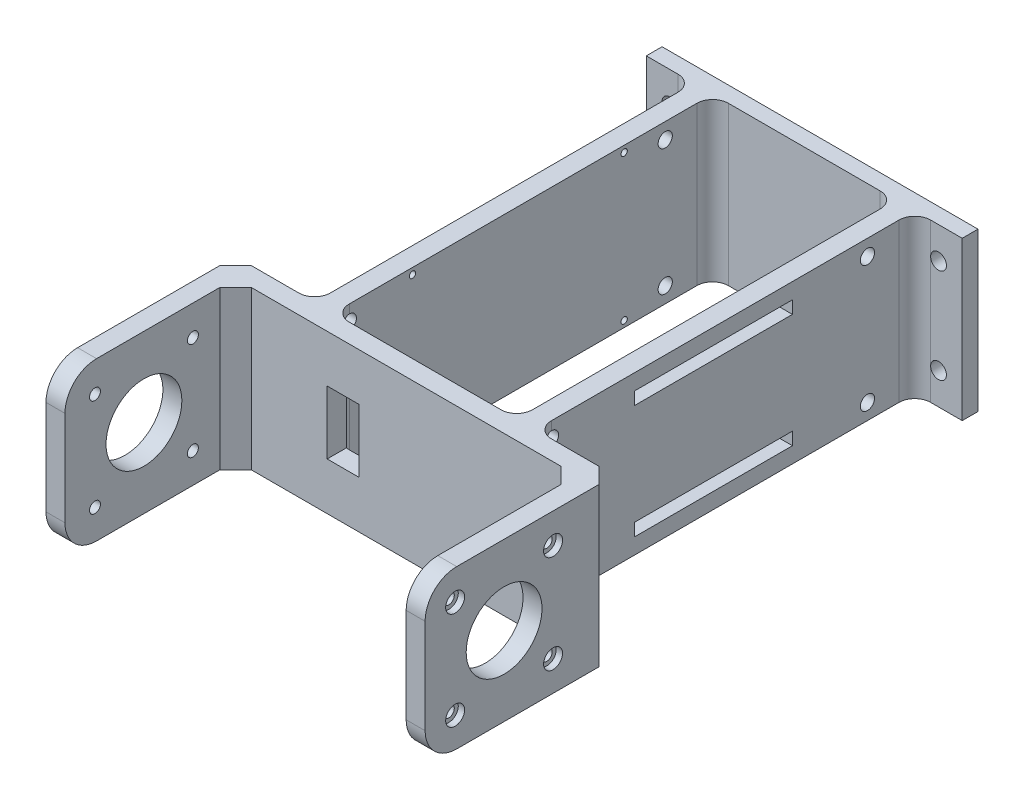
from build123d import *

# Parameters (mm, degrees)
SKETCH1_W           = 120
SKETCH1_H           = 65
SKETCH1_W_2         = 108
SKETCH1_H_2         = 54
BOSS_EXTRUDE1_DEPTH = 50
SKETCH4_R           = 12
CUT_EXTRUDE1_DEPTH  = 156
SKETCH7_R           = 1.735318072
CUT_EXTRUDE2_DEPTH  = 156
SKETCH9_R           = 3
CUT_EXTRUDE3_DEPTH  = 2
CUT_EXTRUDE4_START  = -2
SKETCH10_R          = 3
CUT_EXTRUDE4_DEPTH  = 2
SKETCH11_W          = 6
SKETCH11_H          = 50
BOSS_EXTRUDE2_DEPTH = 120
SKETCH13_W          = 120
SKETCH13_H          = 5
CUT_EXTRUDE5_DEPTH  = 120
FILLET1_R           = 10
SKETCH14_W          = 100
SKETCH14_H          = 50
BOSS_EXTRUDE3_DEPTH = 5
SKETCH15_R          = 2.5
CUT_EXTRUDE6_DEPTH  = 18
SKETCH16_W          = 50
SKETCH16_H          = 4
CUT_EXTRUDE7_DEPTH  = 18
SKETCH17_R          = 1
CUT_EXTRUDE8_DEPTH  = 18
SKETCH18_W          = 10
SKETCH18_H          = 20
CUT_EXTRUDE9_DEPTH  = 18
SKETCH22_R          = 2.25
CUT_EXTRUDE13_DEPTH = 75
CHAMFER1_SIZE       = 5
CHAMFER2_SIZE       = 5
FILLET2_R           = 5


with BuildPart() as part:
    # Sketch1 → Boss-Extrude1 (new body)
    with BuildSketch(Plane(origin=(0, 0, 0), x_dir=(1, 0, 0), z_dir=(0, 1, 0))):
        with Locations((0, 2.5)):
            Rectangle(SKETCH1_W, SKETCH1_H)
        with Locations((0, 2)):
            Rectangle(SKETCH1_W_2, SKETCH1_H_2, mode=Mode.SUBTRACT)
    extrude(amount=BOSS_EXTRUDE1_DEPTH)

    # Sketch4 → Cut-Extrude1 (cut)
    with BuildSketch(Plane.ZY.offset(60)):
        with Locations((0, 25)):
            Circle(SKETCH4_R)
    extrude(amount=-CUT_EXTRUDE1_DEPTH, mode=Mode.SUBTRACT)

    # Sketch7 → Cut-Extrude2 (cut)
    with BuildSketch(Plane.ZY.offset(60)):
        with Locations((-15.5, 9.5)):
            Circle(SKETCH7_R)
        with Locations((-15.5, 40.5)):
            Circle(SKETCH7_R)
        with Locations((15.5, 9.5)):
            Circle(SKETCH7_R)
        with Locations((15.5, 40.5)):
            Circle(SKETCH7_R)
    extrude(amount=-CUT_EXTRUDE2_DEPTH, mode=Mode.SUBTRACT)

    # Sketch9 → Cut-Extrude3 (cut)
    with BuildSketch(Plane(origin=(60, 0, 0), x_dir=(0, 0, -1), z_dir=(1, 0, 0))):
        with Locations((15.5, 40.5)):
            Circle(SKETCH9_R)
        with Locations((15.5, 9.5)):
            Circle(SKETCH9_R)
        with Locations((-15.5, 9.5)):
            Circle(SKETCH9_R)
        with Locations((-15.5, 40.5)):
            Circle(SKETCH9_R)
    extrude(amount=-CUT_EXTRUDE3_DEPTH, mode=Mode.SUBTRACT)

    # Sketch10 → Cut-Extrude4 (cut)
    with BuildSketch(Plane.ZY.offset(60).offset(CUT_EXTRUDE4_START)):
        with Locations(Location((-15.5, 9.5, 0), (0, 0, 180))):
            Circle(SKETCH10_R)
        with Locations(Location((-15.5, 40.5, 0), (0, 0, 180))):
            Circle(SKETCH10_R)
        with Locations(Location((15.5, 40.5, 0), (0, 0, 180))):
            Circle(SKETCH10_R)
        with Locations(Location((15.5, 9.5, 0), (0, 0, 180))):
            Circle(SKETCH10_R)
    extrude(amount=CUT_EXTRUDE4_DEPTH, mode=Mode.SUBTRACT)

    # Sketch11 → Boss-Extrude2 (add)
    with BuildSketch(Plane(origin=(0, 0, -35), x_dir=(-1, 0, 0), z_dir=(0, 0, -1))):
        with Locations((-32, 25)):
            Rectangle(SKETCH11_W, SKETCH11_H)
        with Locations((32, 25)):
            Rectangle(SKETCH11_W, SKETCH11_H)
    extrude(amount=BOSS_EXTRUDE2_DEPTH)

    # Sketch13 → Cut-Extrude5 (cut)
    with BuildSketch(Plane(origin=(0, 50, 0), x_dir=(1, 0, 0), z_dir=(0, 1, 0))):
        with Locations((0, -27.5)):
            Rectangle(SKETCH13_W, SKETCH13_H)
    extrude(amount=-CUT_EXTRUDE5_DEPTH, mode=Mode.SUBTRACT)

    # Fillet1
    fillet1_edges = [part.edges().sort_by_distance(p)[0] for p in [
        (57, 0, 25),
        (-57, 0, 25),
        (57, 50, 25),
        (-57, 50, 25),
    ]]
    fillet(fillet1_edges, radius=FILLET1_R)

    # Sketch14 → Boss-Extrude3 (add)
    with BuildSketch(Plane(origin=(0, 0, -155), x_dir=(-1, 0, 0), z_dir=(0, 0, -1))):
        with Locations((0, 25)):
            Rectangle(SKETCH14_W, SKETCH14_H)
    extrude(amount=BOSS_EXTRUDE3_DEPTH)

    # Sketch15 → Cut-Extrude6 (cut)
    with BuildSketch(Plane(origin=(0, 0, -160), x_dir=(-1, 0, 0), z_dir=(0, 0, -1))):
        with Locations((-42.5, 10)):
            Circle(SKETCH15_R)
        with Locations((42.5, 10)):
            Circle(SKETCH15_R)
        with Locations((42.5, 40)):
            Circle(SKETCH15_R)
        with Locations((-42.5, 40)):
            Circle(SKETCH15_R)
    extrude(amount=-CUT_EXTRUDE6_DEPTH, mode=Mode.SUBTRACT)

    # Sketch16 → Cut-Extrude7 (cut)
    with BuildSketch(Plane(origin=(35, 0, 0), x_dir=(0, 0, -1), z_dir=(1, 0, 0))):
        with Locations((91.261804775, 43)):
            Rectangle(SKETCH16_W, SKETCH16_H)
        with Locations((91.261804775, 7)):
            Rectangle(SKETCH16_W, SKETCH16_H)
    extrude(amount=-CUT_EXTRUDE7_DEPTH, mode=Mode.SUBTRACT)

    # Sketch17 → Cut-Extrude8 (cut)
    with BuildSketch(Plane.ZY.offset(35)):
        with Locations(Location((-127, 2, 0), (0, 0, 270))):
            Circle(SKETCH17_R)
        with Locations(Location((-127, 48, 0), (0, 0, 270))):
            Circle(SKETCH17_R)
        with Locations(Location((-60, 2, 0), (0, 0, 270))):
            Circle(SKETCH17_R)
        with Locations(Location((-60, 48, 0), (0, 0, 270))):
            Circle(SKETCH17_R)
    extrude(amount=-CUT_EXTRUDE8_DEPTH, mode=Mode.SUBTRACT)

    # Sketch18 → Cut-Extrude9 (cut)
    with BuildSketch(Plane(origin=(0, 0, -35), x_dir=(-1, 0, 0), z_dir=(0, 0, -1))):
        with Locations((20, 25)):
            Rectangle(SKETCH18_W, SKETCH18_H)
    extrude(amount=-CUT_EXTRUDE9_DEPTH, mode=Mode.SUBTRACT)

    # Sketch22 → Cut-Extrude13 (cut)
    with BuildSketch(Plane.ZY.offset(35)):
        with Locations(Location((-140, 5, 0), (0, 0, 270))):
            Circle(SKETCH22_R)
        with Locations(Location((-140, 45, 0), (0, 0, 270))):
            Circle(SKETCH22_R)
        with Locations(Location((-40, 5, 0), (0, 0, 270))):
            Circle(SKETCH22_R)
        with Locations(Location((-40, 45, 0), (0, 0, 270))):
            Circle(SKETCH22_R)
    extrude(amount=-CUT_EXTRUDE13_DEPTH, mode=Mode.SUBTRACT)

    # Chamfer1
    chamfer1_edges = [part.edges().sort_by_distance(p)[0] for p in [
        (-60, 25, -35),
        (60, 25, -35),
    ]]
    chamfer(chamfer1_edges, length=CHAMFER1_SIZE)

    # Chamfer2
    chamfer2_edges = [part.edges().sort_by_distance(p)[0] for p in [
        (-54, 25, -29),
        (54, 25, -29),
    ]]
    chamfer(chamfer2_edges, length=CHAMFER2_SIZE)

    # Fillet2
    # the kernel refuses this fillet: 5 mm, written as the material it adds along each edge
    with BuildSketch(Plane(origin=(-29, 50, -155), x_dir=(1, 0, 0), z_dir=(0, -1, 0)), Plane(origin=(29, 0, -155), x_dir=(-1, 0, 0), z_dir=(0, 1, 0))) as fillet2_piece_1:
        with BuildLine():
            CenterArc((FILLET2_R, FILLET2_R), FILLET2_R, 180, 90)
            Line((0, FILLET2_R), (0, 0))
            Line((0, 0), (FILLET2_R, 0))
        make_face()
    extrude(amount=50)
    with BuildSketch(Plane(origin=(35, 50, -35), x_dir=(1, 0, 0), z_dir=(0, -1, 0))) as fillet2_piece_2_section:
        with BuildLine():
            CenterArc((FILLET2_R, -FILLET2_R), FILLET2_R, 90, 90)
            Line((0, -FILLET2_R), (0, 0))
            Line((0, 0), (FILLET2_R, 0))
        make_face()
    fillet2_piece_2 = extrude(amount=50, mode=Mode.PRIVATE)
    fillet2_piece_2 = fillet2_piece_2 - Plane(origin=(36.144503009, 45, -40), x_dir=(0, -1, 0), z_dir=(-1, 0, 0)) * Cylinder(2.25, 121, mode=Mode.PRIVATE)
    fillet2_piece_2 = fillet2_piece_2 - Plane(origin=(36.144503009, 5, -40), x_dir=(0, -1, 0), z_dir=(-1, 0, 0)) * Cylinder(2.25, 121, mode=Mode.PRIVATE)
    add(fillet2_piece_2)
    with BuildSketch(Plane(origin=(-29, 50, -35), x_dir=(0, 0, -1), z_dir=(0, -1, 0))) as fillet2_piece_3_section:
        with BuildLine():
            CenterArc((FILLET2_R, FILLET2_R), FILLET2_R, 180, 90)
            Line((0, FILLET2_R), (0, 0))
            Line((0, 0), (FILLET2_R, 0))
        make_face()
    fillet2_piece_3 = extrude(amount=50, mode=Mode.PRIVATE)
    fillet2_piece_3 = fillet2_piece_3 - Plane(origin=(-27.918643219, 45, -40), x_dir=(0, -1, 0), z_dir=(-1, 0, 0)) * Cylinder(2.25, 121, mode=Mode.PRIVATE)
    fillet2_piece_3 = split(fillet2_piece_3, bisect_by=Plane(origin=(-27.918643219, 35, -36.105806531), z_dir=(0, 1, 0)), keep=Keep.TOP, mode=Mode.PRIVATE)
    fillet2_piece_3 = split(fillet2_piece_3, bisect_by=Plane(origin=(-25, 42.450189762, -36.105806531), z_dir=(-1, 0, 0)), keep=Keep.TOP, mode=Mode.PRIVATE)
    add(fillet2_piece_3)
    with BuildSketch(Plane(origin=(-29, 50, -35), x_dir=(0, 0, -1), z_dir=(0, -1, 0))) as fillet2_piece_4_section:
        with BuildLine():
            CenterArc((FILLET2_R, FILLET2_R), FILLET2_R, 180, 90)
            Line((0, FILLET2_R), (0, 0))
            Line((0, 0), (FILLET2_R, 0))
        make_face()
    fillet2_piece_4 = extrude(amount=50, mode=Mode.PRIVATE)
    fillet2_piece_4 = split(fillet2_piece_4, bisect_by=Plane(origin=(-24.562912463, 35, -34.970154695), z_dir=(0, 1, 0)), keep=Keep.TOP, mode=Mode.PRIVATE)
    fillet2_piece_4 = split(fillet2_piece_4, bisect_by=Plane(origin=(-25, 42.5, -34.970154695), z_dir=(1, 0, 0)), keep=Keep.TOP, mode=Mode.PRIVATE)
    add(fillet2_piece_4)
    with BuildSketch(Plane(origin=(-29, 50, -35), x_dir=(0, 0, -1), z_dir=(0, -1, 0))) as fillet2_piece_5_section:
        with BuildLine():
            CenterArc((FILLET2_R, FILLET2_R), FILLET2_R, 180, 90)
            Line((0, FILLET2_R), (0, 0))
            Line((0, 0), (FILLET2_R, 0))
        make_face()
    fillet2_piece_5 = extrude(amount=50, mode=Mode.PRIVATE)
    fillet2_piece_5 = split(fillet2_piece_5, bisect_by=Plane(origin=(-27.938736848, 35, -36.15683257), z_dir=(0, -1, 0)), keep=Keep.TOP, mode=Mode.PRIVATE)
    fillet2_piece_5 = split(fillet2_piece_5, bisect_by=Plane(origin=(-27.938736848, 15, -36.15683257), z_dir=(0, 1, 0)), keep=Keep.TOP, mode=Mode.PRIVATE)
    fillet2_piece_5 = split(fillet2_piece_5, bisect_by=Plane(origin=(-25, 25, -36.15683257), z_dir=(-1, 0, 0)), keep=Keep.TOP, mode=Mode.PRIVATE)
    add(fillet2_piece_5)
    with BuildSketch(Plane(origin=(-29, 50, -35), x_dir=(0, 0, -1), z_dir=(0, -1, 0))) as fillet2_piece_6_section:
        with BuildLine():
            CenterArc((FILLET2_R, FILLET2_R), FILLET2_R, 180, 90)
            Line((0, FILLET2_R), (0, 0))
            Line((0, 0), (FILLET2_R, 0))
        make_face()
    fillet2_piece_6 = extrude(amount=50, mode=Mode.PRIVATE)
    fillet2_piece_6 = fillet2_piece_6 - Plane(origin=(-27.918643238, 5, -40), x_dir=(0, -1, 0), z_dir=(-1, 0, 0)) * Cylinder(2.25, 121, mode=Mode.PRIVATE)
    fillet2_piece_6 = split(fillet2_piece_6, bisect_by=Plane(origin=(-27.918643238, 15, -36.105806633), z_dir=(0, -1, 0)), keep=Keep.TOP, mode=Mode.PRIVATE)
    fillet2_piece_6 = split(fillet2_piece_6, bisect_by=Plane(origin=(-25, 7.54981005, -36.105806633), z_dir=(-1, 0, 0)), keep=Keep.TOP, mode=Mode.PRIVATE)
    add(fillet2_piece_6)
    with BuildSketch(Plane(origin=(-29, 50, -35), x_dir=(0, 0, -1), z_dir=(0, -1, 0))) as fillet2_piece_7_section:
        with BuildLine():
            CenterArc((FILLET2_R, FILLET2_R), FILLET2_R, 180, 90)
            Line((0, FILLET2_R), (0, 0))
            Line((0, 0), (FILLET2_R, 0))
        make_face()
    fillet2_piece_7 = extrude(amount=50, mode=Mode.PRIVATE)
    fillet2_piece_7 = split(fillet2_piece_7, bisect_by=Plane(origin=(-24.562912463, 15, -34.970154695), z_dir=(0, -1, 0)), keep=Keep.TOP, mode=Mode.PRIVATE)
    fillet2_piece_7 = split(fillet2_piece_7, bisect_by=Plane(origin=(-25, 7.5, -34.970154695), z_dir=(1, 0, 0)), keep=Keep.TOP, mode=Mode.PRIVATE)
    add(fillet2_piece_7)
    with BuildSketch(Plane(origin=(-35, 0, -35), x_dir=(-1, 0, 0), z_dir=(0, 1, 0))) as fillet2_piece_8_section:
        with BuildLine():
            CenterArc((FILLET2_R, -FILLET2_R), FILLET2_R, 90, 90)
            Line((0, -FILLET2_R), (0, 0))
            Line((0, 0), (FILLET2_R, 0))
        make_face()
    fillet2_piece_8 = extrude(amount=50, mode=Mode.PRIVATE)
    fillet2_piece_8 = fillet2_piece_8 - Plane(origin=(-36.144503009, 5, -40), x_dir=(0, -1, 0), z_dir=(-1, 0, 0)) * Cylinder(2.25, 121, mode=Mode.PRIVATE)
    fillet2_piece_8 = fillet2_piece_8 - Plane(origin=(-36.144503009, 45, -40), x_dir=(0, -1, 0), z_dir=(-1, 0, 0)) * Cylinder(2.25, 121, mode=Mode.PRIVATE)
    add(fillet2_piece_8)
    with BuildSketch(Plane(origin=(29, 0, -35), x_dir=(-1, 0, 0), z_dir=(0, 1, 0))) as fillet2_piece_9_section:
        with BuildLine():
            CenterArc((FILLET2_R, -FILLET2_R), FILLET2_R, 90, 90)
            Line((0, -FILLET2_R), (0, 0))
            Line((0, 0), (FILLET2_R, 0))
        make_face()
    fillet2_piece_9 = extrude(amount=50, mode=Mode.PRIVATE)
    fillet2_piece_9 = fillet2_piece_9 - Plane(origin=(27.855496991, 5, -40), x_dir=(0, -1, 0), z_dir=(-1, 0, 0)) * Cylinder(2.25, 121, mode=Mode.PRIVATE)
    fillet2_piece_9 = fillet2_piece_9 - Plane(origin=(27.855496991, 45, -40), x_dir=(0, -1, 0), z_dir=(-1, 0, 0)) * Cylinder(2.25, 121, mode=Mode.PRIVATE)
    add(fillet2_piece_9)
    with BuildSketch(Plane(origin=(-35, 0, -155), x_dir=(0, 0, 1), z_dir=(0, 1, 0)), Plane(origin=(35, 50, -155), x_dir=(0, 0, 1), z_dir=(0, -1, 0))) as fillet2_piece_10:
        with BuildLine():
            CenterArc((FILLET2_R, -FILLET2_R), FILLET2_R, 90, 90)
            Line((0, -FILLET2_R), (0, 0))
            Line((0, 0), (FILLET2_R, 0))
        make_face()
    extrude(amount=50)


solid = part.part
